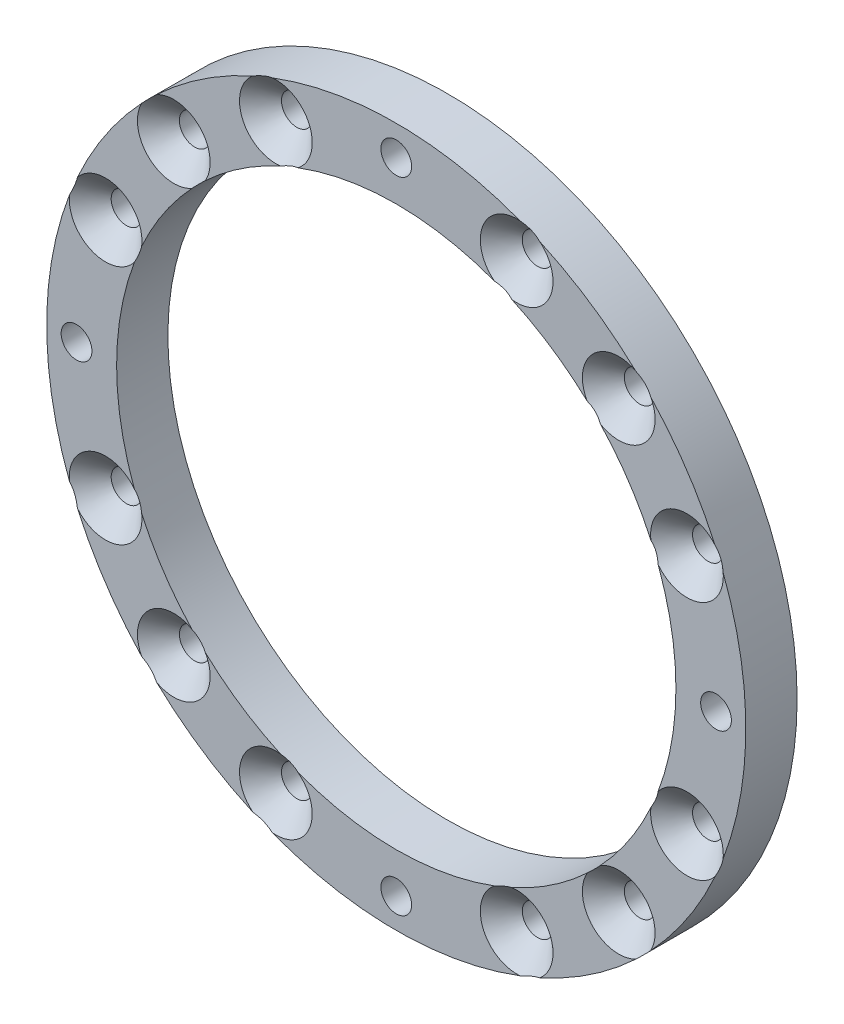
from build123d import *

# Parameters (mm, degrees)
ESQUISSE1_R             = 37.5
ESQUISSE1_R_2           = 30
BOSS_EXTRU_1_DEPTH      = 5.5
ESQUISSE2_R             = 1.65
ENL_V_MAT_EXTRU_1_DEPTH = 54.31744555
CHANFREIN1_SIZE         = 2.25


with BuildPart() as part:
    # Esquisse1 → Boss.-Extru.1 (new body)
    with BuildSketch(Plane.XY):
        Circle(ESQUISSE1_R)
        Circle(ESQUISSE1_R_2, mode=Mode.SUBTRACT)
    extrude(amount=BOSS_EXTRU_1_DEPTH)

    # Esquisse2 → Enlèv. mat.-Extru.1 (cut, through all)
    with BuildSketch(Plane.XY.offset(5.5)):
        with Locations((0, 34.3)):
            Circle(ESQUISSE2_R)
        with Locations((12.915565842, 31.180934222)):
            Circle(ESQUISSE2_R)
        with Locations((23.864853865, 23.864853865)):
            Circle(ESQUISSE2_R)
        with Locations((31.180934222, 12.915565842)):
            Circle(ESQUISSE2_R)
        with Locations((34.3, 0)):
            Circle(ESQUISSE2_R)
        with Locations((31.180934222, -12.915565842)):
            Circle(ESQUISSE2_R)
        with Locations((23.864853865, -23.864853865)):
            Circle(ESQUISSE2_R)
        with Locations((12.915565842, -31.180934222)):
            Circle(ESQUISSE2_R)
        with Locations((0, -34.3)):
            Circle(ESQUISSE2_R)
        with Locations((-12.915565842, -31.180934222)):
            Circle(ESQUISSE2_R)
        with Locations((-23.864853865, -23.864853865)):
            Circle(ESQUISSE2_R)
        with Locations((-31.180934222, -12.915565842)):
            Circle(ESQUISSE2_R)
        with Locations((-34.3, 0)):
            Circle(ESQUISSE2_R)
        with Locations((-31.180934222, 12.915565842)):
            Circle(ESQUISSE2_R)
        with Locations((-23.864853865, 23.864853865)):
            Circle(ESQUISSE2_R)
        with Locations((-12.915565842, 31.180934222)):
            Circle(ESQUISSE2_R)
    extrude(amount=-ENL_V_MAT_EXTRU_1_DEPTH, mode=Mode.SUBTRACT)

    # Chanfrein1
    # the kernel refuses this chamfer: 2.25 mm, written as the material it takes off along each edge
    with BuildSketch(Plane(origin=(-12.915565842, 31.180934222, 5.5), x_dir=(1, 0, 0), z_dir=(0, -1, 0))) as chanfrein1_piece_1:
        Polygon((1.65 + CHANFREIN1_SIZE, 0), (1.65, -CHANFREIN1_SIZE), (1.65, 0), align=None)
    revolve(axis=Axis((-12.915565842, 31.180934222, 5.5), (0, 0, 1)), mode=Mode.SUBTRACT)
    with BuildSketch(Plane(origin=(-23.864853865, 23.864853865, 5.5), x_dir=(1, 0, 0), z_dir=(0, -1, 0))) as chanfrein1_piece_2:
        Polygon((1.65 + CHANFREIN1_SIZE, 0), (1.65, -CHANFREIN1_SIZE), (1.65, 0), align=None)
    revolve(axis=Axis((-23.864853865, 23.864853865, 5.5), (0, 0, 1)), mode=Mode.SUBTRACT)
    with BuildSketch(Plane(origin=(-31.180934222, 12.915565842, 5.5), x_dir=(1, 0, 0), z_dir=(0, -1, 0))) as chanfrein1_piece_3:
        Polygon((1.65 + CHANFREIN1_SIZE, 0), (1.65, -CHANFREIN1_SIZE), (1.65, 0), align=None)
    revolve(axis=Axis((-31.180934222, 12.915565842, 5.5), (0, 0, 1)), mode=Mode.SUBTRACT)
    with BuildSketch(Plane(origin=(-31.180934222, -12.915565842, 5.5), x_dir=(1, 0, 0), z_dir=(0, -1, 0))) as chanfrein1_piece_4:
        Polygon((1.65 + CHANFREIN1_SIZE, 0), (1.65, -CHANFREIN1_SIZE), (1.65, 0), align=None)
    revolve(axis=Axis((-31.180934222, -12.915565842, 5.5), (0, 0, 1)), mode=Mode.SUBTRACT)
    with BuildSketch(Plane(origin=(-23.864853865, -23.864853865, 5.5), x_dir=(1, 0, 0), z_dir=(0, -1, 0))) as chanfrein1_piece_5:
        Polygon((1.65 + CHANFREIN1_SIZE, 0), (1.65, -CHANFREIN1_SIZE), (1.65, 0), align=None)
    revolve(axis=Axis((-23.864853865, -23.864853865, 5.5), (0, 0, 1)), mode=Mode.SUBTRACT)
    with BuildSketch(Plane(origin=(-12.915565842, -31.180934222, 5.5), x_dir=(1, 0, 0), z_dir=(0, -1, 0))) as chanfrein1_piece_6:
        Polygon((1.65 + CHANFREIN1_SIZE, 0), (1.65, -CHANFREIN1_SIZE), (1.65, 0), align=None)
    revolve(axis=Axis((-12.915565842, -31.180934222, 5.5), (0, 0, 1)), mode=Mode.SUBTRACT)
    with BuildSketch(Plane(origin=(12.915565842, -31.180934222, 5.5), x_dir=(1, 0, 0), z_dir=(0, -1, 0))) as chanfrein1_piece_7:
        Polygon((1.65 + CHANFREIN1_SIZE, 0), (1.65, -CHANFREIN1_SIZE), (1.65, 0), align=None)
    revolve(axis=Axis((12.915565842, -31.180934222, 5.5), (0, 0, 1)), mode=Mode.SUBTRACT)
    with BuildSketch(Plane(origin=(23.864853865, -23.864853865, 5.5), x_dir=(1, 0, 0), z_dir=(0, -1, 0))) as chanfrein1_piece_8:
        Polygon((1.65 + CHANFREIN1_SIZE, 0), (1.65, -CHANFREIN1_SIZE), (1.65, 0), align=None)
    revolve(axis=Axis((23.864853865, -23.864853865, 5.5), (0, 0, 1)), mode=Mode.SUBTRACT)
    with BuildSketch(Plane(origin=(31.180934222, -12.915565842, 5.5), x_dir=(1, 0, 0), z_dir=(0, -1, 0))) as chanfrein1_piece_9:
        Polygon((1.65 + CHANFREIN1_SIZE, 0), (1.65, -CHANFREIN1_SIZE), (1.65, 0), align=None)
    revolve(axis=Axis((31.180934222, -12.915565842, 5.5), (0, 0, 1)), mode=Mode.SUBTRACT)
    with BuildSketch(Plane(origin=(31.180934222, 12.915565842, 5.5), x_dir=(1, 0, 0), z_dir=(0, -1, 0))) as chanfrein1_piece_10:
        Polygon((1.65 + CHANFREIN1_SIZE, 0), (1.65, -CHANFREIN1_SIZE), (1.65, 0), align=None)
    revolve(axis=Axis((31.180934222, 12.915565842, 5.5), (0, 0, 1)), mode=Mode.SUBTRACT)
    with BuildSketch(Plane(origin=(23.864853865, 23.864853865, 5.5), x_dir=(1, 0, 0), z_dir=(0, -1, 0))) as chanfrein1_piece_11:
        Polygon((1.65 + CHANFREIN1_SIZE, 0), (1.65, -CHANFREIN1_SIZE), (1.65, 0), align=None)
    revolve(axis=Axis((23.864853865, 23.864853865, 5.5), (0, 0, 1)), mode=Mode.SUBTRACT)
    with BuildSketch(Plane(origin=(12.915565842, 31.180934222, 5.5), x_dir=(1, 0, 0), z_dir=(0, -1, 0))) as chanfrein1_piece_12:
        Polygon((1.65 + CHANFREIN1_SIZE, 0), (1.65, -CHANFREIN1_SIZE), (1.65, 0), align=None)
    revolve(axis=Axis((12.915565842, 31.180934222, 5.5), (0, 0, 1)), mode=Mode.SUBTRACT)


solid = part.part
